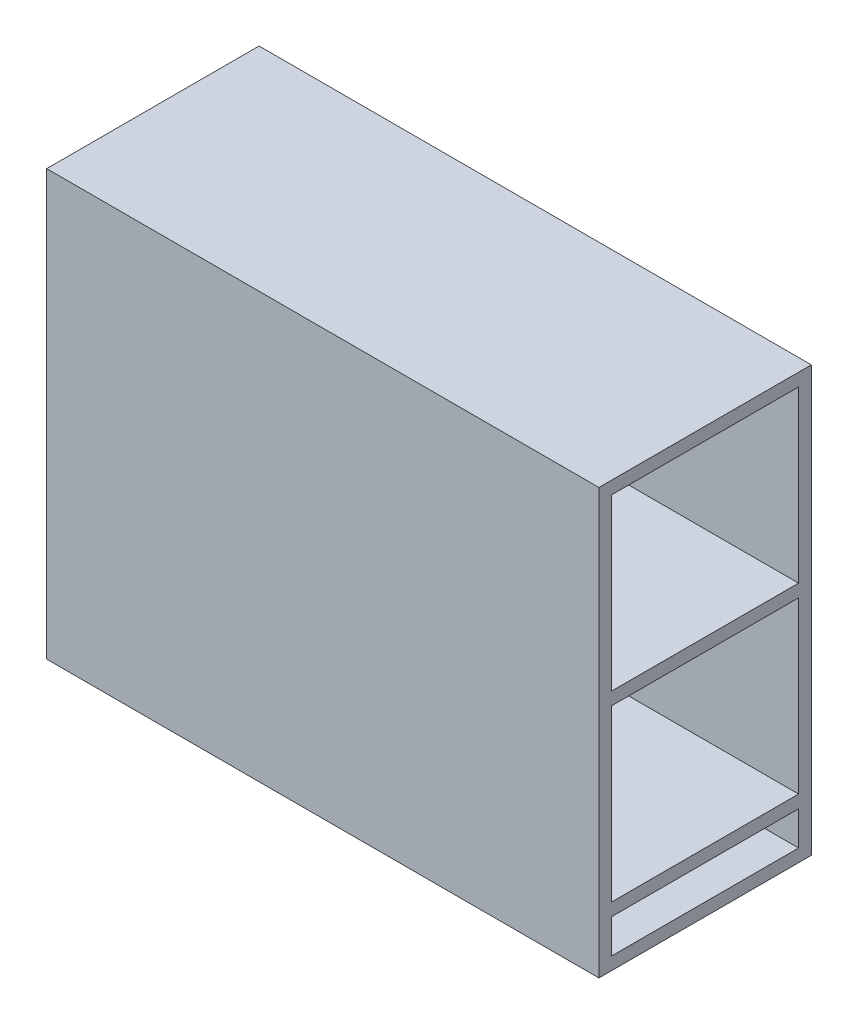
from build123d import *

# Parameters (mm, degrees)
ESQUISSE1_W             = 130
ESQUISSE1_H             = 50
BOSS_EXTRU_1_DEPTH      = 100
ESQUISSE2_W             = 44
ESQUISSE2_H             = 40
ENL_V_MAT_EXTRU_1_DEPTH = 127
ESQUISSE3_W             = 44
ESQUISSE3_H             = 40
ENL_V_MAT_EXTRU_2_DEPTH = 127
COQUE1_START            = -47
COQUE1_OUTLINE_W        = 127
COQUE1_OUTLINE_H        = 8
COQUE1_DEPTH            = 44


# Read off the part's stored shape, not the designer's step: Coque1
with BuildPart() as part:
    # Esquisse1 → Boss.-Extru.1 (new body)
    with BuildSketch(Plane(origin=(0, 0, 0), x_dir=(1, 0, 0), z_dir=(0, 1, 0))):
        with Locations((65, 25)):
            Rectangle(ESQUISSE1_W, ESQUISSE1_H)
    extrude(amount=BOSS_EXTRU_1_DEPTH)

    # Esquisse2 → Enlèv. mat.-Extru.1 (cut)
    with BuildSketch(Plane(origin=(130, 0, 0), x_dir=(0, 0, -1), z_dir=(1, 0, 0))):
        with Locations((25, 77)):
            Rectangle(ESQUISSE2_W, ESQUISSE2_H)
    extrude(amount=-ENL_V_MAT_EXTRU_1_DEPTH, mode=Mode.SUBTRACT)

    # Esquisse3 → Enlèv. mat.-Extru.2 (cut)
    with BuildSketch(Plane(origin=(130, 0, 0), x_dir=(0, 0, -1), z_dir=(1, 0, 0))):
        with Locations((25, 34)):
            Rectangle(ESQUISSE3_W, ESQUISSE3_H)
    extrude(amount=-ENL_V_MAT_EXTRU_2_DEPTH, mode=Mode.SUBTRACT)

    # Coque1 outline → Coque1 (cut)
    with BuildSketch(Plane.XY.offset(COQUE1_START)):
        with Locations((66.5, 7)):
            Rectangle(COQUE1_OUTLINE_W, COQUE1_OUTLINE_H)
    extrude(amount=COQUE1_DEPTH, mode=Mode.SUBTRACT)


solid = part.part
